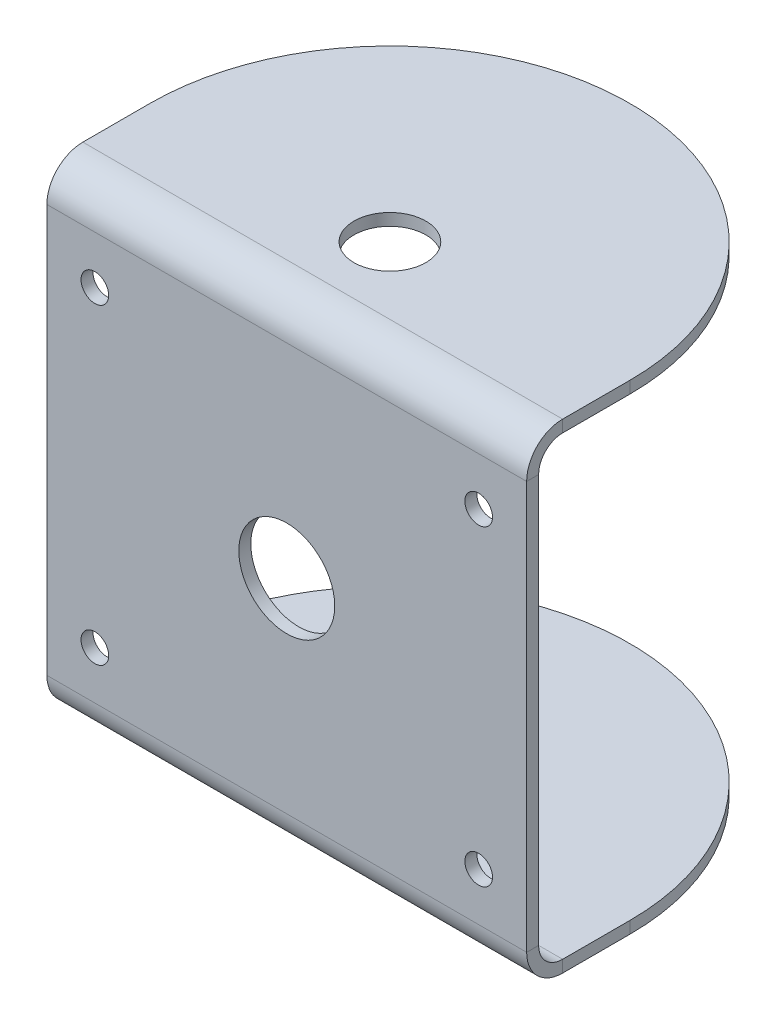
from build123d import *

# Parameters (mm, degrees)
BASE_FLANGE1_DEPTH          = 31.75
SKETCH6_R                   = 4.7625
CUT_EXTRUDE1_DEPTH          = 127
F_27_0_144_DIAMETER_HOLE1_D = 3.6576
SKETCH11_R                  = 6.35
CUT_EXTRUDE2_DEPTH          = 2.54


# Sheet-metal steps are written as plain solids
with BuildPart() as part:
    # Sketch1 → Base-Flange1 (new, symmetric)
    with BuildSketch(Plane.YZ):
        with BuildLine():
            Line((-31.75, -22.70125), (-31.75, 17.93875))
            ThreePointArc((-31.75, 17.93875), (-30.355096045, 21.306346045), (-26.9875, 22.70125))
            Line((-26.9875, 22.70125), (26.9875, 22.70125))
            ThreePointArc((26.9875, 22.70125), (30.355096045, 21.306346045), (31.75, 17.93875))
            Line((31.75, 17.93875), (31.75, -22.70125))
            Line((31.75, -22.70125), (30.1625, -22.70125))
            Line((30.1625, -22.70125), (30.1625, 17.93875))
            ThreePointArc((30.1625, 17.93875), (29.23256403, 20.18381403), (26.9875, 21.11375))
            Line((26.9875, 21.11375), (-26.9875, 21.11375))
            ThreePointArc((-26.9875, 21.11375), (-29.23256403, 20.18381403), (-30.1625, 17.93875))
            Line((-30.1625, 17.93875), (-30.1625, -22.70125))
            Line((-30.1625, -22.70125), (-31.75, -22.70125))
        make_face()
    extrude(amount=BASE_FLANGE1_DEPTH, both=True)

    # Sketch6 → Cut-Extrude1 (cut)
    with BuildSketch(Plane(origin=(0, 31.75, 0), x_dir=(-1, 0, 0), z_dir=(0, 1, 0))):
        with Locations(Location((0, 9.04875, 0), (0, 0, 270))):
            Circle(SKETCH6_R)
        with BuildLine():
            Line((-31.75, 9.04875), (-31.75, -117.95125))
            Line((-31.75, -117.95125), (31.75, -117.95125))
            Line((31.75, -117.95125), (31.75, 9.04875))
            ThreePointArc((31.75, 9.04875), (0, -22.70125), (-31.75, 9.04875))
        make_face()
    extrude(amount=-CUT_EXTRUDE1_DEPTH, mode=Mode.SUBTRACT)

    # #27 (0.144) Diameter Hole1 (through all)
    with Locations(Plane.XY.offset(22.70125)):
        with Locations((-25.4, 20.6375), (25.4, 20.6375), (25.4, -20.6375), (-25.4, -20.6375)):
            Hole(F_27_0_144_DIAMETER_HOLE1_D / 2)

    # Sketch11 → Cut-Extrude2 (cut)
    with BuildSketch(Plane.XY.offset(22.70125)):
        Circle(SKETCH11_R)
    extrude(amount=-CUT_EXTRUDE2_DEPTH, mode=Mode.SUBTRACT)


solid = part.part
